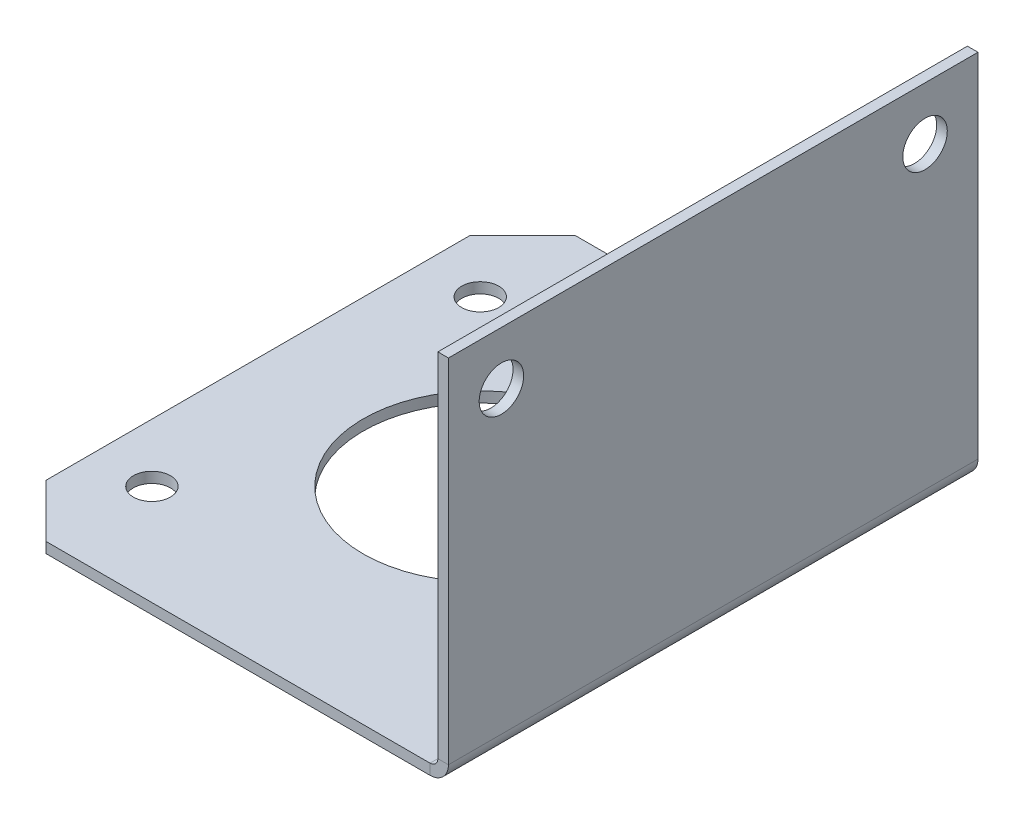
from build123d import *

# Parameters (mm, degrees)
SKETCH1_W                    = 43
SKETCH1_H                    = 50
BASE_FLANGE1_DEPTH           = 1
SKETCH2_R                    = 11.05
SKETCH2_R_2                  = 1.75
CUT_EXTRUDE1_DEPTH           = 50.749371855
EDGE_FLANGE1_STRIP_W         = 5.4732
EDGE_FLANGE1_STRIP_H         = 1
EDGE_FLANGE1_STRIP_CUT_DEPTH = 50
EDGE_FLANGE1_DEPTH           = 50
CUT_EXTRUDE2_REACH           = 61.54
SKETCH8_R                    = 2.1
CHAMFER1_SIZE                = 5


# Sheet-metal steps are written as plain solids
with BuildPart() as part:
    # Sketch1 → Base-Flange1 (new body)
    with BuildSketch(Plane(origin=(0, 0, 0), x_dir=(1, 0, 0), z_dir=(0, 1, 0))):
        with Locations((21.5, 0)):
            Rectangle(SKETCH1_W, SKETCH1_H)
    extrude(amount=-BASE_FLANGE1_DEPTH)

    # Sketch2 → Cut-Extrude1 (cut, through all)
    with BuildSketch(Plane(origin=(0, 0, 0), x_dir=(1, 0, 0), z_dir=(0, 1, 0))):
        with Locations(Location((21, 0, 0), (0, 0, 270))):
            Circle(SKETCH2_R)
        with Locations(Location((5.5, 15.5, 0), (0, 0, 270))):
            Circle(SKETCH2_R_2)
        with Locations(Location((36.5, 15.5, 0), (0, 0, 270))):
            Circle(SKETCH2_R_2)
        with Locations(Location((36.5, -15.5, 0), (0, 0, 270))):
            Circle(SKETCH2_R_2)
        with Locations(Location((5.5, -15.5, 0), (0, 0, 270))):
            Circle(SKETCH2_R_2)
    extrude(amount=-CUT_EXTRUDE1_DEPTH, mode=Mode.SUBTRACT)

    # Edge-Flange1 strip (across the edge) → Edge-Flange1 strip cut (cut)
    with BuildSketch(Plane(origin=(43, 0, 25), x_dir=(-1, 0, 0), z_dir=(0, 0, -1))):
        with Locations((-1, -0.5)):
            Rectangle(EDGE_FLANGE1_STRIP_W, EDGE_FLANGE1_STRIP_H)
    extrude(amount=EDGE_FLANGE1_STRIP_CUT_DEPTH, mode=Mode.SUBTRACT)

    # Edge-Flange1 section (across the edge) → Edge-Flange1 (add)
    with BuildSketch(Plane(origin=(43, 0, 25), x_dir=(-1, 0, 0), z_dir=(0, 0, -1))):
        with BuildLine():
            Line((0, 0.7366), (0, 34))
            Line((0, 34), (1, 34))
            Line((1, 34), (1, 0.7366))
            ThreePointArc((1, 0.7366), (1.215745145, 0.215745145), (1.7366, 0))
            Line((1.7366, 0), (1.7366, -1))
            ThreePointArc((1.7366, -1), (0.508638364, -0.491361636), (0, 0.7366))
        make_face()
    extrude(amount=EDGE_FLANGE1_DEPTH)

    # Sketch8 → Cut-Extrude2 (cut, up to next)
    with BuildSketch(Plane.ZY.offset(-42), mode=Mode.PRIVATE) as cut_extrude2_sk1:
        with Locations(Location((20, 29, 0), (0, 0, 270))):
            Circle(SKETCH8_R)
    cut_extrude2_tool1 = extrude(cut_extrude2_sk1.sketch, amount=-CUT_EXTRUDE2_REACH, mode=Mode.PRIVATE) & part.part
    # Sketch8 → Cut-Extrude2 (cut, up to next)
    with BuildSketch(Plane.ZY.offset(-42), mode=Mode.PRIVATE) as cut_extrude2_sk2:
        with Locations(Location((-20, 29, 0), (0, 0, 270))):
            Circle(SKETCH8_R)
    cut_extrude2_tool2 = extrude(cut_extrude2_sk2.sketch, amount=-CUT_EXTRUDE2_REACH, mode=Mode.PRIVATE) & part.part
    add(cut_extrude2_tool1.solids().sort_by_distance((42, 29, 20))[0], mode=Mode.SUBTRACT)
    add(cut_extrude2_tool2.solids().sort_by_distance((42, 29, -20))[0], mode=Mode.SUBTRACT)

    # Chamfer1
    chamfer1_edges = [part.edges().sort_by_distance(p)[0] for p in [
        (0, -0.5, -25),
        (0, -0.5, 25),
    ]]
    chamfer(chamfer1_edges, length=CHAMFER1_SIZE)


solid = part.part
